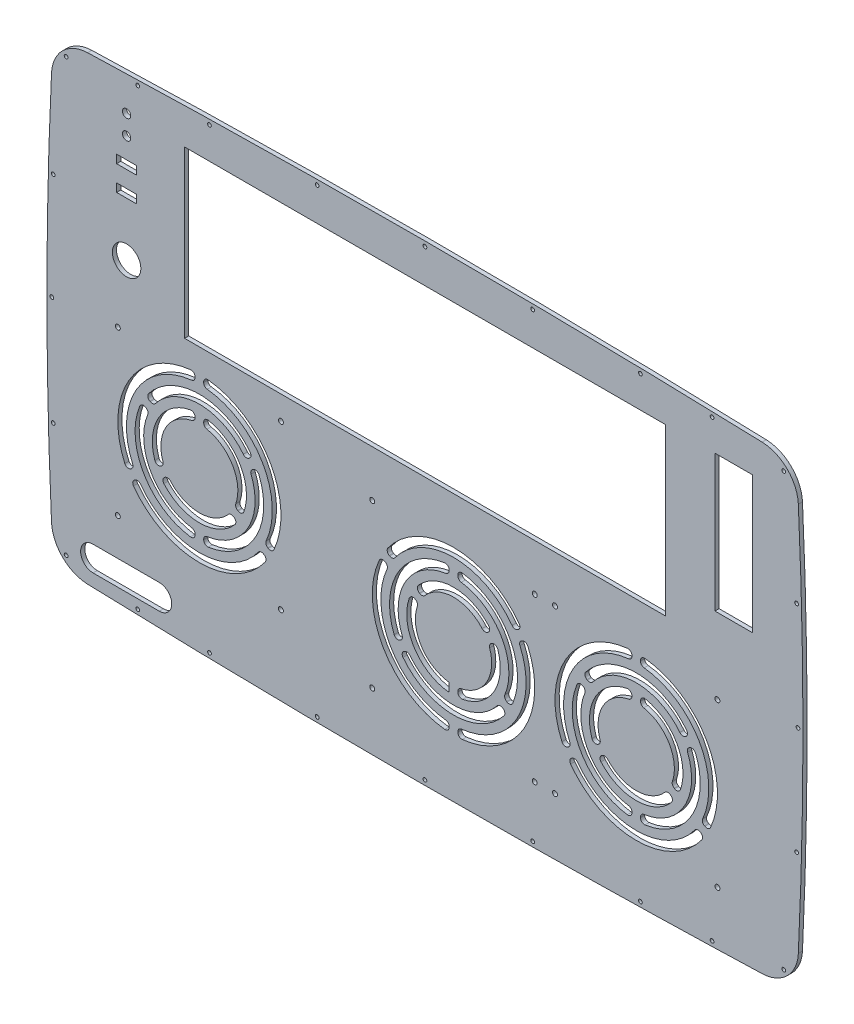
from build123d import *

# Parameters (mm, degrees)
SKETCH1_R           = 1.435
SKETCH1_R_2         = 1.4351
BOSS_EXTRUDE1_DEPTH = 3.175
SKETCH2_W           = 368.3
SKETCH2_H           = 127
CUT_EXTRUDE1_DEPTH  = 342.698968356
SKETCH4_R           = 1.89865
CUT_EXTRUDE2_DEPTH  = 582.628032103
SKETCH5_R           = 1.89865
CUT_EXTRUDE3_DEPTH  = 342.698968356
SKETCH6_R           = 3.175
SKETCH6_W           = 15.24
SKETCH6_H           = 6.35
SKETCH6_W_2         = 28.575
SKETCH6_H_2         = 104.775
CUT_EXTRUDE4_DEPTH  = 342.698968356
SKETCH7_R           = 10.922
CUT_EXTRUDE5_DEPTH  = 342.698968356
CUT_EXTRUDE8_DEPTH  = 342.698968356
CUT_EXTRUDE9_DEPTH  = 342.698968356
FILLET4_R           = 3.048
CUT_EXTRUDE10_DEPTH = 342.698968356


with BuildPart() as part:
    # Sketch1 → Boss-Extrude1 (new body)
    with BuildSketch(Plane.XY):
        with BuildLine():
            ThreePointArc((2.968751211, -181.189695026), (41.295889155, -181.079537948), (79.6220041, -180.778621425))
            Line((79.6220041, -180.778621425), (85.559165015, -180.714940362))
            ThreePointArc((85.559165015, -180.714940362), (123.887667874, -180.193645916), (162.213100977, -179.481566675))
            ThreePointArc((162.213100977, -179.481566675), (165.18118139, -179.418457741), (168.149237253, -179.35420455))
            ThreePointArc((168.149237253, -179.35420455), (192.659124698, -178.779845314), (217.167059321, -178.127456184))
            ThreePointArc((217.167059321, -178.127456184), (220.135246662, -178.043143258), (223.103401271, -177.957685792))
            Line((223.103401271, -177.957685792), (258.423629847, -176.852835003))
            ThreePointArc((258.423629847, -176.852835003), (267.290868319, -175.133004675), (275.18450496, -170.742533734))
            ThreePointArc((275.18450496, -170.742533734), (277.610750544, -168.6061656), (279.781359306, -166.210504095))
            ThreePointArc((279.781359306, -166.210504095), (284.283709644, -158.379432473), (286.129131597, -149.53685032))
            ThreePointArc((286.129131597, -149.53685032), (287.482131945, -117.828809116), (288.512976487, -86.108660213))
            ThreePointArc((288.512976487, -86.108660213), (288.592974065, -83.139049998), (288.670148028, -80.169365063))
            ThreePointArc((288.670148028, -80.169365063), (289.416235277, -41.572865854), (289.685382101, -2.970094485))
            ThreePointArc((289.685382101, -2.970094485), (289.686328933, 0.0005929), (289.684451162, 2.971279842))
            ThreePointArc((289.684451162, 2.971279842), (289.409759592, 41.084465923), (288.670148028, 79.191465063))
            ThreePointArc((288.670148028, 79.191465063), (288.592974065, 82.161149998), (288.512976487, 85.130760213))
            ThreePointArc((288.512976487, 85.130760213), (287.482131945, 116.850909116), (286.129131597, 148.55895032))
            ThreePointArc((286.129131597, 148.55895032), (284.283709644, 157.401532473), (279.781359306, 165.232604095))
            ThreePointArc((279.781359306, 165.232604095), (277.610750544, 167.6282656), (275.18450496, 169.764633734))
            ThreePointArc((275.18450496, 169.764633734), (267.290868319, 174.155104675), (258.423629847, 175.874935003))
            ThreePointArc((258.423629847, 175.874935003), (240.76414932, 176.447620699), (223.103401271, 176.979785792))
            ThreePointArc((223.103401271, 176.979785792), (220.135246662, 177.065243258), (217.167059321, 177.149556184))
            ThreePointArc((217.167059321, 177.149556184), (192.659124698, 177.801945314), (168.149237253, 178.37630455))
            ThreePointArc((168.149237253, 178.37630455), (165.18118139, 178.440557741), (162.213100977, 178.503666675))
            ThreePointArc((162.213100977, 178.503666675), (123.887667874, 179.215745916), (85.559165015, 179.737040362))
            ThreePointArc((85.559165015, 179.737040362), (82.590590695, 179.769453121), (79.6220041, 179.800721425))
            ThreePointArc((79.6220041, 179.800721425), (41.295889155, 180.101637948), (2.968751211, 180.211795026))
            ThreePointArc((2.968751211, 180.211795026), (0, 180.212367286), (-2.968751211, 180.211795026))
            ThreePointArc((-2.968751211, 180.211795026), (-41.295889155, 180.101637948), (-79.6220041, 179.800721425))
            ThreePointArc((-79.6220041, 179.800721425), (-82.590590695, 179.769453121), (-85.559165015, 179.737040362))
            ThreePointArc((-85.559165015, 179.737040362), (-123.887667874, 179.215745916), (-162.213100977, 178.503666675))
            ThreePointArc((-162.213100977, 178.503666675), (-165.18118139, 178.440557741), (-168.149237253, 178.37630455))
            ThreePointArc((-168.149237253, 178.37630455), (-192.659124698, 177.801945314), (-217.167059321, 177.149556184))
            ThreePointArc((-217.167059321, 177.149556184), (-220.135246662, 177.065243258), (-223.103401271, 176.979785792))
            ThreePointArc((-223.103401271, 176.979785792), (-240.76414932, 176.447620699), (-258.423629847, 175.874935003))
            ThreePointArc((-258.423629847, 175.874935003), (-267.290868319, 174.155104675), (-275.18450496, 169.764633734))
            ThreePointArc((-275.18450496, 169.764633734), (-277.610750544, 167.6282656), (-279.781359306, 165.232604095))
            ThreePointArc((-279.781359306, 165.232604095), (-284.283709644, 157.401532473), (-286.129131597, 148.55895032))
            ThreePointArc((-286.129131597, 148.55895032), (-287.482131945, 116.850909116), (-288.512976487, 85.130760213))
            ThreePointArc((-288.512976487, 85.130760213), (-288.592974065, 82.161149998), (-288.670148028, 79.191465063))
            ThreePointArc((-288.670148028, 79.191465063), (-289.409759592, 41.084465923), (-289.684451162, 2.971279842))
            ThreePointArc((-289.684451162, 2.971279842), (-289.686328933, 0.0005929), (-289.685382101, -2.970094485))
            ThreePointArc((-289.685382101, -2.970094485), (-289.416235277, -41.572865854), (-288.670148028, -80.169365063))
            ThreePointArc((-288.670148028, -80.169365063), (-288.592974065, -83.139049998), (-288.512976487, -86.108660213))
            ThreePointArc((-288.512976487, -86.108660213), (-287.482131945, -117.828809116), (-286.129131597, -149.53685032))
            ThreePointArc((-286.129131597, -149.53685032), (-284.283709644, -158.379432473), (-279.781359306, -166.210504095))
            ThreePointArc((-279.781359306, -166.210504095), (-277.610750544, -168.6061656), (-275.18450496, -170.742533734))
            ThreePointArc((-275.18450496, -170.742533734), (-267.290868319, -175.133004675), (-258.423629847, -176.852835003))
            ThreePointArc((-258.423629847, -176.852835003), (-240.76414932, -177.425520699), (-223.103401271, -177.957685792))
            ThreePointArc((-223.103401271, -177.957685792), (-220.135246662, -178.043143258), (-217.167059321, -178.127456184))
            ThreePointArc((-217.167059321, -178.127456184), (-192.659124698, -178.779845314), (-168.149237253, -179.35420455))
            ThreePointArc((-168.149237253, -179.35420455), (-165.18118139, -179.418457741), (-162.213100977, -179.481566675))
            ThreePointArc((-162.213100977, -179.481566675), (-123.887667874, -180.193645916), (-85.559165015, -180.714940362))
            ThreePointArc((-85.559165015, -180.714940362), (-82.590590695, -180.747353121), (-79.6220041, -180.778621425))
            ThreePointArc((-79.6220041, -180.778621425), (-41.295889155, -181.079537948), (-2.968751211, -181.189695026))
            ThreePointArc((-2.968751211, -181.189695026), (0, -181.190267286), (2.968751211, -181.189695026))
        make_face()
        with Locations((-274.954150451, -165.911566346)):
            Circle(SKETCH1_R, mode=Mode.SUBTRACT)
        with Locations((-220.027075225, -174.260724966)):
            Circle(SKETCH1_R_2, mode=Mode.SUBTRACT)
        with Locations((-165.1, -175.63472853)):
            Circle(SKETCH1_R_2, mode=Mode.SUBTRACT)
        with Locations((-82.55, -176.962970799)):
            Circle(SKETCH1_R_2, mode=Mode.SUBTRACT)
        with Locations((0, -177.405667286)):
            Circle(SKETCH1_R_2, mode=Mode.SUBTRACT)
        with Locations((-284.81033356, -83.03895)):
            Circle(SKETCH1_R_2, mode=Mode.SUBTRACT)
        with Locations((82.55, -176.962970799)):
            Circle(SKETCH1_R_2, mode=Mode.SUBTRACT)
        with Locations((165.1, -175.63472853)):
            Circle(SKETCH1_R_2, mode=Mode.SUBTRACT)
        with Locations((220.027075225, -174.260724966)):
            Circle(SKETCH1_R_2, mode=Mode.SUBTRACT)
        with Locations((274.954150451, -165.911566346)):
            Circle(SKETCH1_R_2, mode=Mode.SUBTRACT)
        with Locations((284.81033356, -83.03895)):
            Circle(SKETCH1_R_2, mode=Mode.SUBTRACT)
        with Locations((-285.902364234, 0)):
            Circle(SKETCH1_R_2, mode=Mode.SUBTRACT)
        with Locations((-284.81033356, 82.06105)):
            Circle(SKETCH1_R_2, mode=Mode.SUBTRACT)
        with Locations((-274.954150451, 164.933666346)):
            Circle(SKETCH1_R_2, mode=Mode.SUBTRACT)
        with Locations((-220.027075225, 173.282824966)):
            Circle(SKETCH1_R_2, mode=Mode.SUBTRACT)
        with Locations((-165.1, 174.65682853)):
            Circle(SKETCH1_R_2, mode=Mode.SUBTRACT)
        with Locations((-82.55, 175.985070799)):
            Circle(SKETCH1_R_2, mode=Mode.SUBTRACT)
        with Locations((0, 176.427767286)):
            Circle(SKETCH1_R_2, mode=Mode.SUBTRACT)
        with Locations((285.902364234, 0)):
            Circle(SKETCH1_R_2, mode=Mode.SUBTRACT)
        with Locations((284.81033356, 82.06105)):
            Circle(SKETCH1_R_2, mode=Mode.SUBTRACT)
        with Locations((82.55, 175.985070799)):
            Circle(SKETCH1_R_2, mode=Mode.SUBTRACT)
        with Locations((165.1, 174.65682853)):
            Circle(SKETCH1_R_2, mode=Mode.SUBTRACT)
        with Locations((220.027075225, 173.282824966)):
            Circle(SKETCH1_R_2, mode=Mode.SUBTRACT)
        with Locations((274.954150451, 164.933666346)):
            Circle(SKETCH1_R_2, mode=Mode.SUBTRACT)
    extrude(amount=BOSS_EXTRUDE1_DEPTH)

    # Sketch2 → Cut-Extrude1 (cut, through all)
    with BuildSketch(Plane.XY.offset(3.175)):
        with Locations((0, 86.974935003)):
            Rectangle(SKETCH2_W, SKETCH2_H)
    extrude(amount=-CUT_EXTRUDE1_DEPTH, mode=Mode.SUBTRACT)

    # Sketch4 → Cut-Extrude2 (cut, through all)
    with BuildSketch(Plane(origin=(212.760943823, -112.751430244, 0), x_dir=(0, -1, 0), z_dir=(0, 0, -1))):
        with Locations((-100.549863898, 253.106793372)):
            Circle(SKETCH4_R)
        with Locations((23.950136102, 253.106793372)):
            Circle(SKETCH4_R)
        with Locations((-100.549863898, 128.606793372)):
            Circle(SKETCH4_R)
        with Locations((-100.549863898, 113.106793372)):
            Circle(SKETCH4_R)
        with Locations((23.950136102, 128.606793372)):
            Circle(SKETCH4_R)
        with Locations((23.950136102, 113.106793372)):
            Circle(SKETCH4_R)
        with Locations((-100.549863898, -11.393206628)):
            Circle(SKETCH4_R)
        with Locations((23.950136102, -11.393206628)):
            Circle(SKETCH4_R)
    extrude(amount=-CUT_EXTRUDE2_DEPTH, mode=Mode.SUBTRACT)

    # Sketch5 → Cut-Extrude3 (cut, through all)
    with BuildSketch(Plane(origin=(0, 0, 0), x_dir=(-1, 0, 0), z_dir=(0, 0, -1))):
        with Locations((235.329131597, -119.702835003)):
            Circle(SKETCH5_R)
        with Locations((110.329131597, -119.702835003)):
            Circle(SKETCH5_R)
        with Locations((110.329131597, 5.297164997)):
            Circle(SKETCH5_R)
        with Locations((235.329131597, 5.297164997)):
            Circle(SKETCH5_R)
    extrude(amount=-CUT_EXTRUDE3_DEPTH, mode=Mode.SUBTRACT)

    # Sketch6 → Cut-Extrude4 (cut, through all)
    with BuildSketch(Plane(origin=(0, 0, 0), x_dir=(-1, 0, 0), z_dir=(0, 0, -1))):
        with Locations((228.6, 150.474935003)):
            Circle(SKETCH6_R)
        with Locations((228.6, 135.539735003)):
            Circle(SKETCH6_R)
        with Locations((228.6, 116.489735003)):
            Rectangle(SKETCH6_W, SKETCH6_H)
        with Locations((228.6, 97.439735003)):
            Rectangle(SKETCH6_W, SKETCH6_H)
        with Locations((-236.5375, 98.087435003)):
            Rectangle(SKETCH6_W_2, SKETCH6_H_2)
    extrude(amount=-CUT_EXTRUDE4_DEPTH, mode=Mode.SUBTRACT)

    # Sketch7 → Cut-Extrude5 (cut, through all)
    with BuildSketch(Plane(origin=(0, 0, 0), x_dir=(-1, 0, 0), z_dir=(0, 0, -1))):
        with Locations((228.6, 52.989735003)):
            Circle(SKETCH7_R)
    extrude(amount=-CUT_EXTRUDE5_DEPTH, mode=Mode.SUBTRACT)

    # Sketch8 → Cut-Extrude8 (cut, through all)
    with BuildSketch(Plane(origin=(0, 0, 0), x_dir=(-1, 0, 0), z_dir=(0, 0, -1))):
        with BuildLine():
            Line((-165.206150451, -18.903622081), (-165.206150451, -12.289203971))
            ThreePointArc((-165.206150451, -12.289203971), (-215.814231836, -43.326566346), (-217.389335426, -102.67313165))
            Line((-217.389335426, -102.67313165), (-211.661081312, -99.365922595))
            ThreePointArc((-211.661081312, -99.365922595), (-210.09500007, -46.628566346), (-165.206150451, -18.903622081))
        make_face()
        with BuildLine():
            ThreePointArc((-106.418965475, -102.67313165), (-107.994069065, -43.326566346), (-158.602150451, -12.289203971))
            Line((-158.602150451, -12.289203971), (-158.602150451, -18.903622081))
            ThreePointArc((-158.602150451, -18.903622081), (-113.713300832, -46.628566346), (-112.14721959, -99.365922595))
            Line((-112.14721959, -99.365922595), (-106.418965475, -102.67313165))
        make_face()
        with BuildLine():
            Line((-208.359081312, -105.085154361), (-214.087335426, -108.392363417))
            ThreePointArc((-214.087335426, -108.392363417), (-161.904150451, -136.701566346), (-109.720965475, -108.392363417))
            Line((-109.720965475, -108.392363417), (-115.44921959, -105.085154361))
            ThreePointArc((-115.44921959, -105.085154361), (-161.904150451, -130.097566346), (-208.359081312, -105.085154361))
        make_face()
        with BuildLine():
            Line((-126.914183215, -50.437278165), (-121.179910982, -47.126594549))
            ThreePointArc((-121.179910982, -47.126594549), (-161.904150451, -25.409566346), (-202.628389919, -47.126594549))
            Line((-202.628389919, -47.126594549), (-196.894117687, -50.437278165))
            ThreePointArc((-196.894117687, -50.437278165), (-161.904150451, -32.013566346), (-126.914183215, -50.437278165))
        make_face()
        with BuildLine():
            ThreePointArc((-158.602150451, -123.382278174), (-119.432532598, -98.972566346), (-117.877910982, -52.845826315))
            Line((-117.877910982, -52.845826315), (-123.612183215, -56.156509932))
            ThreePointArc((-123.612183215, -56.156509932), (-125.151764365, -95.670566346), (-158.602150451, -116.76091094))
            Line((-158.602150451, -116.76091094), (-158.602150451, -123.382278174))
        make_face()
        with BuildLine():
            Line((-200.196117687, -56.156509932), (-205.930389919, -52.845826315))
            ThreePointArc((-205.930389919, -52.845826315), (-204.375768303, -98.972566346), (-165.206150451, -123.382278174))
            Line((-165.206150451, -123.382278174), (-165.206150451, -116.76091094))
            ThreePointArc((-165.206150451, -116.76091094), (-198.656536537, -95.670566346), (-200.196117687, -56.156509932))
        make_face()
        with BuildLine():
            Line((-135.101266386, -86.113397498), (-129.352029694, -89.43272085))
            ThreePointArc((-129.352029694, -89.43272085), (-130.870996132, -56.534566346), (-158.602150451, -38.770025572))
            Line((-158.602150451, -38.770025572), (-158.602150451, -45.408672275))
            ThreePointArc((-158.602150451, -45.408672275), (-136.590227898, -59.836566346), (-135.101266386, -86.113397498))
        make_face()
        with BuildLine():
            ThreePointArc((-191.154271207, -95.151952616), (-161.904150451, -110.285566346), (-132.654029694, -95.151952616))
            Line((-132.654029694, -95.151952616), (-138.403266386, -91.832629265))
            ThreePointArc((-138.403266386, -91.832629265), (-161.904150451, -103.681566346), (-185.405034515, -91.832629265))
            Line((-185.405034515, -91.832629265), (-191.154271207, -95.151952616))
        make_face()
        with BuildLine():
            ThreePointArc((-165.206150451, -38.770025572), (-192.93730477, -56.534566346), (-194.456271207, -89.43272085))
            Line((-194.456271207, -89.43272085), (-188.707034515, -86.113397498))
            ThreePointArc((-188.707034515, -86.113397498), (-187.218073003, -59.836566346), (-165.206150451, -45.408672275))
            Line((-165.206150451, -45.408672275), (-165.206150451, -38.770025572))
        make_face()
        with BuildLine():
            Line((-18.602150451, -129.99951061), (-18.602150451, -136.613928721))
            ThreePointArc((-18.602150451, -136.613928721), (32.005930935, -105.576566346), (33.581034525, -46.230001042))
            Line((33.581034525, -46.230001042), (27.85278041, -49.537210097))
            ThreePointArc((27.85278041, -49.537210097), (26.286699168, -102.274566346), (-18.602150451, -129.99951061))
        make_face()
        with BuildLine():
            ThreePointArc((-77.389335426, -46.230001042), (-75.814231836, -105.576566346), (-25.206150451, -136.613928721))
            Line((-25.206150451, -136.613928721), (-25.206150451, -129.99951061))
            ThreePointArc((-25.206150451, -129.99951061), (-70.09500007, -102.274566346), (-71.661081312, -49.537210097))
            Line((-71.661081312, -49.537210097), (-77.389335426, -46.230001042))
        make_face()
        with BuildLine():
            ThreePointArc((30.279034525, -40.510769275), (-21.904150451, -12.201566346), (-74.087335426, -40.510769275))
            Line((-74.087335426, -40.510769275), (-68.359081312, -43.81797833))
            ThreePointArc((-68.359081312, -43.81797833), (-21.904150451, -18.805566346), (24.55078041, -43.81797833))
            Line((24.55078041, -43.81797833), (30.279034525, -40.510769275))
        make_face()
        with BuildLine():
            Line((-56.894117687, -98.465854526), (-62.628389919, -101.776538143))
            ThreePointArc((-62.628389919, -101.776538143), (-21.904150451, -123.493566346), (18.820089018, -101.776538143))
            Line((18.820089018, -101.776538143), (13.085816785, -98.465854526))
            ThreePointArc((13.085816785, -98.465854526), (-21.904150451, -116.889566346), (-56.894117687, -98.465854526))
        make_face()
        with BuildLine():
            ThreePointArc((-25.206150451, -25.520854518), (-64.375768303, -49.930566346), (-65.930389919, -96.057306377))
            Line((-65.930389919, -96.057306377), (-60.196117687, -92.74662276))
            ThreePointArc((-60.196117687, -92.74662276), (-58.656536537, -53.232566346), (-25.206150451, -32.142221752))
            Line((-25.206150451, -32.142221752), (-25.206150451, -25.520854518))
        make_face()
        with BuildLine():
            Line((16.387816785, -92.74662276), (22.122089018, -96.057306377))
            ThreePointArc((22.122089018, -96.057306377), (20.567467402, -49.930566346), (-18.602150451, -25.520854518))
            Line((-18.602150451, -25.520854518), (-18.602150451, -32.142221752))
            ThreePointArc((-18.602150451, -32.142221752), (14.848235635, -53.232566346), (16.387816785, -92.74662276))
        make_face()
        with BuildLine():
            Line((-48.707034515, -62.789735194), (-54.456271207, -59.470411842))
            ThreePointArc((-54.456271207, -59.470411842), (-52.93730477, -92.368566346), (-25.206150451, -110.13310712))
            Line((-25.206150451, -110.13310712), (-25.206150451, -103.494460417))
            ThreePointArc((-25.206150451, -103.494460417), (-47.218073003, -89.066566346), (-48.707034515, -62.789735194))
        make_face()
        with BuildLine():
            ThreePointArc((7.345970306, -53.751180076), (-21.904150451, -38.617566346), (-51.154271207, -53.751180076))
            Line((-51.154271207, -53.751180076), (-45.405034515, -57.070503427))
            ThreePointArc((-45.405034515, -57.070503427), (-21.904150451, -45.221566346), (1.596733614, -57.070503427))
            Line((1.596733614, -57.070503427), (7.345970306, -53.751180076))
        make_face()
        with BuildLine():
            Line((-18.602150451, -103.494460417), (-18.602150451, -110.13310712))
            ThreePointArc((-18.602150451, -110.13310712), (9.129003868, -92.368566346), (10.647970306, -59.470411842))
            Line((10.647970306, -59.470411842), (4.898733614, -62.789735194))
            ThreePointArc((4.898733614, -62.789735194), (3.409772102, -89.066566346), (-18.602150451, -103.494460417))
        make_face()
    extrude(amount=-CUT_EXTRUDE8_DEPTH, mode=Mode.SUBTRACT)

    # Sketch12 → Cut-Extrude9 (cut, through all)
    with BuildSketch(Plane.XY.offset(3.175)):
        with BuildLine():
            Line((-176.131131597, -1.404451406), (-176.131131597, 5.209878414))
            ThreePointArc((-176.131131597, 5.209878414), (-226.955719333, -25.952835003), (-228.531126935, -85.549575827))
            Line((-228.531126935, -85.549575827), (-222.802949282, -82.242410918))
            ThreePointArc((-222.802949282, -82.242410918), (-221.236487567, -29.254835003), (-176.131131597, -1.404451406))
        make_face()
        with BuildLine():
            ThreePointArc((-117.127136259, -85.549575827), (-118.70254386, -25.952835003), (-169.527131597, 5.209878414))
            Line((-169.527131597, 5.209878414), (-169.527131597, -1.404451406))
            ThreePointArc((-169.527131597, -1.404451406), (-124.421775627, -29.254835003), (-122.855313912, -82.242410918))
            Line((-122.855313912, -82.242410918), (-117.127136259, -85.549575827))
        make_face()
        with BuildLine():
            Line((-219.500949282, -87.961642684), (-225.229126935, -91.268807594))
            ThreePointArc((-225.229126935, -91.268807594), (-172.829131597, -119.702835003), (-120.429136259, -91.268807594))
            Line((-120.429136259, -91.268807594), (-126.157313912, -87.961642684))
            ThreePointArc((-126.157313912, -87.961642684), (-172.829131597, -113.098835003), (-219.500949282, -87.961642684))
        make_face()
        with BuildLine():
            Line((-137.622003524, -33.063168955), (-131.887895861, -29.752580352))
            ThreePointArc((-131.887895861, -29.752580352), (-172.829131597, -7.910835003), (-213.770367333, -29.752580352))
            Line((-213.770367333, -29.752580352), (-208.036259669, -33.063168955))
            ThreePointArc((-208.036259669, -33.063168955), (-172.829131597, -14.514835003), (-137.622003524, -33.063168955))
        make_face()
        with BuildLine():
            ThreePointArc((-169.527131597, -106.384112538), (-130.141007393, -81.848835003), (-128.585895861, -35.471812118))
            Line((-128.585895861, -35.471812118), (-134.320003524, -38.782400721))
            ThreePointArc((-134.320003524, -38.782400721), (-135.86023916, -78.546835003), (-169.527131597, -99.762935331))
            Line((-169.527131597, -99.762935331), (-169.527131597, -106.384112538))
        make_face()
        with BuildLine():
            Line((-211.338259669, -38.782400721), (-217.072367333, -35.471812118))
            ThreePointArc((-217.072367333, -35.471812118), (-215.5172558, -81.848835003), (-176.131131597, -106.384112538))
            Line((-176.131131597, -106.384112538), (-176.131131597, -99.762935331))
            ThreePointArc((-176.131131597, -99.762935331), (-209.798024034, -78.546835003), (-211.338259669, -38.782400721))
        make_face()
        with BuildLine():
            Line((-145.808358303, -68.99046456), (-140.059585856, -72.309519879))
            ThreePointArc((-140.059585856, -72.309519879), (-141.579470927, -39.160835003), (-169.527131597, -21.270233482))
            Line((-169.527131597, -21.270233482), (-169.527131597, -27.908344121))
            ThreePointArc((-169.527131597, -27.908344121), (-147.298702693, -42.462835003), (-145.808358303, -68.99046456))
        make_face()
        with BuildLine():
            ThreePointArc((-202.296677337, -78.028751646), (-172.829131597, -93.286835003), (-143.361585856, -78.028751646))
            Line((-143.361585856, -78.028751646), (-149.110358303, -74.709696327))
            ThreePointArc((-149.110358303, -74.709696327), (-172.829131597, -86.682835003), (-196.547904891, -74.709696327))
            Line((-196.547904891, -74.709696327), (-202.296677337, -78.028751646))
        make_face()
        with BuildLine():
            ThreePointArc((-176.131131597, -21.270233482), (-204.078792267, -39.160835003), (-205.598677337, -72.309519879))
            Line((-205.598677337, -72.309519879), (-199.849904891, -68.99046456))
            ThreePointArc((-199.849904891, -68.99046456), (-198.3595605, -42.462835003), (-176.131131597, -27.908344121))
            Line((-176.131131597, -27.908344121), (-176.131131597, -21.270233482))
        make_face()
    extrude(amount=-CUT_EXTRUDE9_DEPTH, mode=Mode.SUBTRACT)

    # Fillet4
    fillet4_edges = [part.edges().sort_by_distance(p)[0] for p in [
        (123.612183215, -56.156509932, 1.5875),
        (158.602150451, -45.408672275, 1.5875),
        (165.206150451, -38.770025572, 1.5875),
        (165.206150451, -45.408672275, 1.5875),
        (158.602150451, -38.770025572, 1.5875),
        (165.206150451, -12.289203971, 1.5875),
        (121.179910982, -47.126594549, 1.5875),
        (126.914183215, -50.437278165, 1.5875),
        (117.877910982, -52.845826315, 1.5875),
        (135.101266386, -86.113397498, 1.5875),
        (129.352029694, -89.43272085, 1.5875),
        (112.14721959, -99.365922595, 1.5875),
        (106.418965475, -102.67313165, 1.5875),
        (109.720965475, -108.392363417, 1.5875),
        (115.44921959, -105.085154361, 1.5875),
        (158.602150451, -123.382278174, 1.5875),
        (158.602150451, -116.76091094, 1.5875),
        (132.654029694, -95.151952616, 1.5875),
        (138.403266386, -91.832629265, 1.5875),
        (185.405034515, -91.832629265, 1.5875),
        (191.154271207, -95.151952616, 1.5875),
        (165.206150451, -123.382278174, 1.5875),
        (165.206150451, -116.76091094, 1.5875),
        (214.087335426, -108.392363417, 1.5875),
        (208.359081312, -105.085154361, 1.5875),
        (217.389335426, -102.67313165, 1.5875),
        (211.661081312, -99.365922595, 1.5875),
        (194.456271207, -89.43272085, 1.5875),
        (188.707034515, -86.113397498, 1.5875),
        (205.930389919, -52.845826315, 1.5875),
        (200.196117687, -56.156509932, 1.5875),
        (202.628389919, -47.126594549, 1.5875),
        (196.894117687, -50.437278165, 1.5875),
        (165.206150451, -18.903622081, 1.5875),
        (158.602150451, -18.903622081, 1.5875),
        (158.602150451, -12.289203971, 1.5875),
        (-134.320003524, -38.782400721, 1.5875),
        (-128.585895861, -35.471812118, 1.5875),
        (-137.622003524, -33.063168955, 1.5875),
        (-131.887895861, -29.752580352, 1.5875),
        (-169.527131597, 5.209878414, 1.5875),
        (-169.527131597, -1.404451406, 1.5875),
        (-176.131131597, -1.404451406, 1.5875),
        (-176.131131597, 5.209878414, 1.5875),
        (-169.527131597, -21.270233482, 1.5875),
        (-169.527131597, -27.908344121, 1.5875),
        (-176.131131597, -27.908344121, 1.5875),
        (-176.131131597, -21.270233482, 1.5875),
        (-208.036259669, -33.063168955, 1.5875),
        (-211.338259669, -38.782400721, 1.5875),
        (-213.770367333, -29.752580352, 1.5875),
        (-217.072367333, -35.471812118, 1.5875),
        (-225.229126935, -91.268807594, 1.5875),
        (-219.500949282, -87.961642684, 1.5875),
        (-222.802949282, -82.242410918, 1.5875),
        (-228.531126935, -85.549575827, 1.5875),
        (-176.131131597, -106.384112538, 1.5875),
        (-176.131131597, -99.762935331, 1.5875),
        (-199.849904891, -68.99046456, 1.5875),
        (-205.598677337, -72.309519879, 1.5875),
        (-196.547904891, -74.709696327, 1.5875),
        (-202.296677337, -78.028751646, 1.5875),
        (-140.059585856, -72.309519879, 1.5875),
        (-145.808358303, -68.99046456, 1.5875),
        (-143.361585856, -78.028751646, 1.5875),
        (-149.110358303, -74.709696327, 1.5875),
        (-169.527131597, -106.384112538, 1.5875),
        (-169.527131597, -99.762935331, 1.5875),
        (-120.429136259, -91.268807594, 1.5875),
        (-117.127136259, -85.549575827, 1.5875),
        (-122.855313912, -82.242410918, 1.5875),
        (-126.157313912, -87.961642684, 1.5875),
        (54.456271207, -59.470411842, 1.5875),
        (48.707034515, -62.789735194, 1.5875),
        (45.405034515, -57.070503427, 1.5875),
        (51.154271207, -53.751180076, 1.5875),
        (-7.345970306, -53.751180076, 1.5875),
        (-1.596733614, -57.070503427, 1.5875),
        (-4.898733614, -62.789735194, 1.5875),
        (-10.647970306, -59.470411842, 1.5875),
        (-16.387816785, -92.74662276, 1.5875),
        (-22.122089018, -96.057306377, 1.5875),
        (-13.085816785, -98.465854526, 1.5875),
        (-18.820089018, -101.776538143, 1.5875),
        (25.206150451, -136.613928721, 1.5875),
        (18.602150451, -136.613928721, 1.5875),
        (18.602150451, -129.99951061, 1.5875),
        (25.206150451, -129.99951061, 1.5875),
        (25.206150451, -103.494460417, 1.5875),
        (25.206150451, -110.13310712, 1.5875),
        (56.894117687, -98.465854526, 1.5875),
        (62.628389919, -101.776538143, 1.5875),
        (65.930389919, -96.057306377, 1.5875),
        (60.196117687, -92.74662276, 1.5875),
        (71.661081312, -49.537210097, 1.5875),
        (77.389335426, -46.230001042, 1.5875),
        (74.087335426, -40.510769275, 1.5875),
        (25.206150451, -25.520854518, 1.5875),
        (25.206150451, -32.142221752, 1.5875),
        (18.602150451, -32.142221752, 1.5875),
        (18.602150451, -25.520854518, 1.5875),
        (68.359081312, -43.81797833, 1.5875),
        (-24.55078041, -43.81797833, 1.5875),
        (-27.85278041, -49.537210097, 1.5875),
        (-30.279034525, -40.510769275, 1.5875),
        (-33.581034525, -46.230001042, 1.5875),
    ]]
    fillet(fillet4_edges, radius=FILLET4_R)

    # Sketch13 → Cut-Extrude10 (cut, through all)
    with BuildSketch(Plane.XY.offset(3.175)):
        with BuildLine():
            Line((-254.317075225, -148.225724966), (-203.517075225, -148.225724966))
            ThreePointArc((-203.517075225, -148.225724966), (-193.992075225, -157.750724966), (-203.517075225, -167.275724966))
            Line((-203.517075225, -167.275724966), (-254.317075225, -167.275724966))
            ThreePointArc((-254.317075225, -167.275724966), (-263.842075225, -157.750724966), (-254.317075225, -148.225724966))
        make_face()
    extrude(amount=-CUT_EXTRUDE10_DEPTH, mode=Mode.SUBTRACT)


solid = part.part
